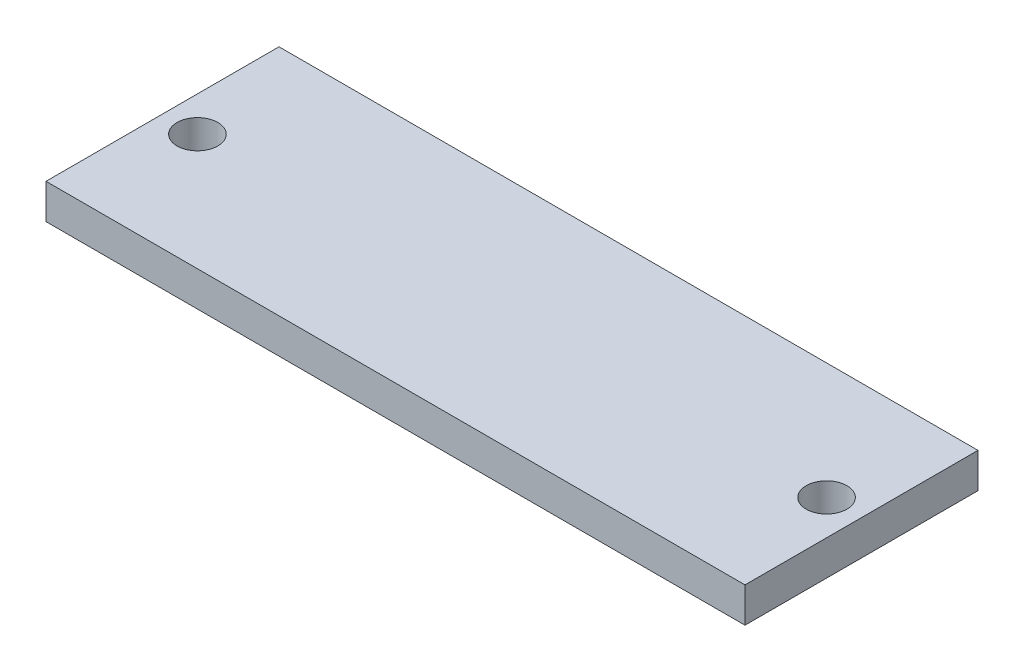
from build123d import *

# Parameters (mm, degrees)
ESQUISSE1_W               = 120
ESQUISSE1_H               = 40
T_LE_DE_BASE_PLI_E1_DEPTH = 6
D_GAGEMENT_M61_D          = 7


# Sheet-metal steps are written as plain solids
with BuildPart() as part:
    # Esquisse1 → Tôle de base pliée1 (new body)
    with BuildSketch(Plane(origin=(0, 0, 0), x_dir=(1, 0, 0), z_dir=(0, 1, 0))):
        Rectangle(ESQUISSE1_W, ESQUISSE1_H)
    extrude(amount=-T_LE_DE_BASE_PLI_E1_DEPTH)

    # Dégagement M61 (through all)
    with Locations(Plane(origin=(0, 0, 0), x_dir=(1, 0, 0), z_dir=(0, 1, 0))):
        with Locations((54, 0), (-54, 0)):
            Hole(D_GAGEMENT_M61_D / 2)


solid = part.part
